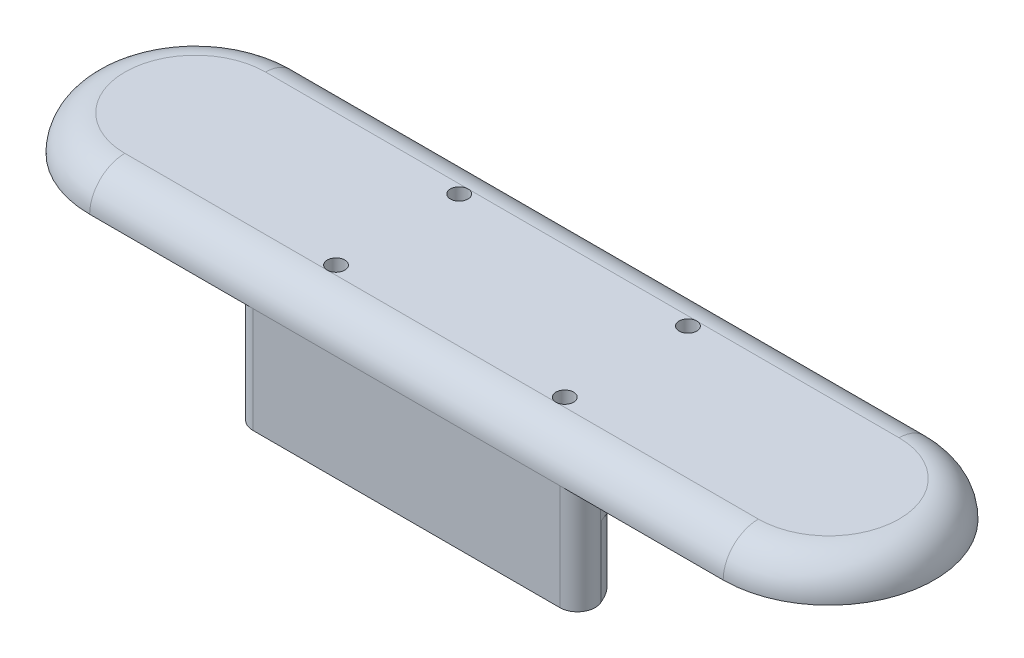
from build123d import *

# Parameters (mm, degrees)
BOSS_EXTRUDE1_DEPTH     = 40
FILLET1_R               = 10
CUT_EXTRUDE1_DEPTH      = 30
SKETCH4_R               = 5
BOSS_EXTRUDE3_DEPTH     = 10
CUT_EXTRUDE2_REACH      = 181.038
CUT_EXTRUDE2_END_RADIUS = 60
SKETCH5_W               = 20
SKETCH5_H               = 40
FILLET2_R               = 5
CUT_EXTRUDE3_REACH      = 153.142
SKETCH6_R               = 1
SKETCH7_R               = 2.5
CUT_EXTRUDE4_DEPTH      = 5
SKETCH8_R               = 6
CUT_EXTRUDE5_DEPTH      = 20
FILLET3_R               = 15


with BuildPart() as part:
    # Sketch1 → Boss-Extrude1 (new body)
    with BuildSketch(Plane(origin=(0, 0, 0), x_dir=(1, 0, 0), z_dir=(0, 1, 0))):
        with BuildLine():
            Line((-67.694698117, 31.515169882), (112.305301883, 31.515169882))
            ThreePointArc((112.305301883, 31.515169882), (142.305301883, 1.515169882), (112.305301883, -28.484830118))
            Line((112.305301883, -28.484830118), (-67.694698117, -28.484830118))
            ThreePointArc((-67.694698117, -28.484830118), (-97.694698117, 1.515169882), (-67.694698117, 31.515169882))
        make_face()
    extrude(amount=BOSS_EXTRUDE1_DEPTH)

    # Fillet1
    fillet1_edges = [part.edges().sort_by_distance(p)[0] for p in [
        (142.305301883, 40, -1.515169882),
        (22.305301883, 40, -31.515169882),
        (-97.694698117, 40, -1.515169882),
        (22.305301883, 40, 28.484830118),
    ]]
    fillet(fillet1_edges, radius=FILLET1_R)

    # Sketch3 → Cut-Extrude1 (cut)
    with BuildSketch(Plane.XZ):
        with BuildLine():
            Line((73.949041486, -31.515169882), (148.949041486, -31.515169882))
            Line((148.949041486, -31.515169882), (148.949041486, 28.484830118))
            Line((148.949041486, 28.484830118), (73.949041486, 28.484830118))
            ThreePointArc((73.949041486, 28.484830118), (65.910565713, -1.515169882), (73.949041486, -31.515169882))
        make_face()
        with BuildLine():
            Line((-29.33843772, 28.484830118), (-104.33843772, 28.484830118))
            Line((-104.33843772, 28.484830118), (-104.33843772, -31.515169882))
            Line((-104.33843772, -31.515169882), (-29.33843772, -31.515169882))
            ThreePointArc((-29.33843772, -31.515169882), (-21.299961947, -1.515169882), (-29.33843772, 28.484830118))
        make_face()
    extrude(amount=-CUT_EXTRUDE1_DEPTH, mode=Mode.SUBTRACT)

    # Sketch4 → Boss-Extrude3 (add)
    with BuildSketch(Plane(origin=(0, 30, 0), x_dir=(-1, 0, 0), z_dir=(0, -1, 0))):
        with Locations(Location((-112.305301883, 1.515169882, 0), (0, 0, 90))):
            Circle(SKETCH4_R)
        with Locations(Location((67.694698117, 1.515169882, 0), (0, 0, 270))):
            Circle(SKETCH4_R)
    extrude(amount=BOSS_EXTRUDE3_DEPTH)

    # Cut-Extrude2: up to this cylinder (the profile starts outside it)
    cut_extrude2_end = Plane(origin=(-81.299961947, 0, -1.515169882), z_dir=(0, -1, 0)) * Cylinder(CUT_EXTRUDE2_END_RADIUS, 483.076, mode=Mode.PRIVATE)
    # Sketch5 → Cut-Extrude2 (cut, up to the surface)
    with BuildSketch(Plane(origin=(73.949041486, 0, 0), x_dir=(0, 0, -1), z_dir=(1, 0, 0)), mode=Mode.PRIVATE) as cut_extrude2_sk1:
        with Locations((1.515169882, 0)):
            Rectangle(SKETCH5_W, SKETCH5_H)
    cut_extrude2_tool1 = extrude(cut_extrude2_sk1.sketch, amount=-CUT_EXTRUDE2_REACH, mode=Mode.PRIVATE) - cut_extrude2_end
    add(cut_extrude2_tool1.solids().sort_by_distance((73.949041, 0, -1.51517))[0], mode=Mode.SUBTRACT)

    # Fillet2
    # the kernel refuses this fillet: 5 mm, written as the material it takes off along each edge
    with BuildSketch(Plane(origin=(-29.33843772, -20.096189432, 28.484830118), x_dir=(0.44322659401027775, 0, -0.8964096085841831), z_dir=(0, 1, 0))) as fillet2_piece_1:
        with BuildLine():
            CenterArc((8.044914281, -4.989633951), FILLET2_R, 93.690067526, 112.619864948)
            Line((3.562866238, -7.205766921), (0, 0))
            ThreePointArc((0, 0), (3.861558855, -0.124392586), (7.72311771, 0))
        make_face()
    extrude(amount=50.096189432, mode=Mode.SUBTRACT)
    with BuildSketch(Plane(origin=(-29.33843772, -20.096189432, -31.515169882), x_dir=(1, 0, 0), z_dir=(0, 1, 0))) as fillet2_piece_2:
        with BuildLine():
            CenterArc((8.038475773, -5), FILLET2_R, 90, 112.619864948)
            ThreePointArc((3.423091158, -6.923076923), (1.823052288, -3.406404359), (0, 0))
            Line((0, 0), (8.038475773, 0))
        make_face()
    extrude(amount=50.096189432, mode=Mode.SUBTRACT)
    with BuildSketch(Plane(origin=(73.949041486, -20.096189432, -31.515169882), x_dir=(-1, 0, 0), z_dir=(0, 1, 0))) as fillet2_piece_3:
        with BuildLine():
            CenterArc((8.038475773, 5), FILLET2_R, 157.380135052, 112.619864948)
            ThreePointArc((3.423091158, 6.923076923), (1.823052288, 3.406404359), (0, 0))
            Line((0, 0), (8.038475773, 0))
        make_face()
    extrude(amount=50.096189432, mode=Mode.SUBTRACT)
    with BuildSketch(Plane(origin=(73.949041486, -20.096189432, 28.484830118), x_dir=(-0.4432265940102763, 0, -0.8964096085841838), z_dir=(0, 1, 0))) as fillet2_piece_4:
        with BuildLine():
            CenterArc((8.044914281, 4.989633951), FILLET2_R, 153.690067526, 112.619864948)
            Line((3.562866238, 7.205766921), (0, 0))
            ThreePointArc((0, 0), (3.861558855, 0.124392586), (7.72311771, 0))
        make_face()
    extrude(amount=50.096189432, mode=Mode.SUBTRACT)

    # Sketch6 → Cut-Extrude3 (cut, up to next)
    with BuildSketch(Plane(origin=(0, 0, 0), x_dir=(-1, 0, 0), z_dir=(0, -1, 0)), mode=Mode.PRIVATE) as cut_extrude3_sk1:
        with Locations(Location((10.194698117, -15.984830118, 0), (0, 0, 90))):
            Circle(SKETCH6_R)
    cut_extrude3_tool1 = extrude(cut_extrude3_sk1.sketch, amount=-CUT_EXTRUDE3_REACH, mode=Mode.PRIVATE) & part.part
    # Sketch6 → Cut-Extrude3 (cut, up to next)
    with BuildSketch(Plane(origin=(0, 0, 0), x_dir=(-1, 0, 0), z_dir=(0, -1, 0)), mode=Mode.PRIVATE) as cut_extrude3_sk2:
        with Locations(Location((-54.805301883, -15.984830118, 0), (0, 0, 90))):
            Circle(SKETCH6_R)
    cut_extrude3_tool2 = extrude(cut_extrude3_sk2.sketch, amount=-CUT_EXTRUDE3_REACH, mode=Mode.PRIVATE) & part.part
    # Sketch6 → Cut-Extrude3 (cut, up to next)
    with BuildSketch(Plane(origin=(0, 0, 0), x_dir=(-1, 0, 0), z_dir=(0, -1, 0)), mode=Mode.PRIVATE) as cut_extrude3_sk3:
        with Locations(Location((-54.805301883, 19.015169882, 0), (0, 0, 90))):
            Circle(SKETCH6_R)
    cut_extrude3_tool3 = extrude(cut_extrude3_sk3.sketch, amount=-CUT_EXTRUDE3_REACH, mode=Mode.PRIVATE) & part.part
    # Sketch6 → Cut-Extrude3 (cut, up to next)
    with BuildSketch(Plane(origin=(0, 0, 0), x_dir=(-1, 0, 0), z_dir=(0, -1, 0)), mode=Mode.PRIVATE) as cut_extrude3_sk4:
        with Locations(Location((10.194698117, 19.015169882, 0), (0, 0, 90))):
            Circle(SKETCH6_R)
    cut_extrude3_tool4 = extrude(cut_extrude3_sk4.sketch, amount=-CUT_EXTRUDE3_REACH, mode=Mode.PRIVATE) & part.part
    add(cut_extrude3_tool1.solids().sort_by_distance((-10.194698, 0, 15.98483))[0], mode=Mode.SUBTRACT)
    add(cut_extrude3_tool2.solids().sort_by_distance((54.805302, 0, 15.98483))[0], mode=Mode.SUBTRACT)
    add(cut_extrude3_tool3.solids().sort_by_distance((54.805302, 0, -19.01517))[0], mode=Mode.SUBTRACT)
    add(cut_extrude3_tool4.solids().sort_by_distance((-10.194698, 0, -19.01517))[0], mode=Mode.SUBTRACT)

    # Sketch7 → Cut-Extrude4 (cut)
    with BuildSketch(Plane(origin=(0, 40, 0), x_dir=(1, 0, 0), z_dir=(0, 1, 0))):
        with Locations(Location((-10.194698117, 19.015169882, 0), (0, 0, 270))):
            Circle(SKETCH7_R)
        with Locations(Location((-10.194698117, -15.984830118, 0), (0, 0, 270))):
            Circle(SKETCH7_R)
        with Locations(Location((54.805301883, -15.984830118, 0), (0, 0, 270))):
            Circle(SKETCH7_R)
        with Locations(Location((54.805301883, 19.015169882, 0), (0, 0, 270))):
            Circle(SKETCH7_R)
    extrude(amount=-CUT_EXTRUDE4_DEPTH, mode=Mode.SUBTRACT)

    # Sketch8 → Cut-Extrude5 (cut)
    with BuildSketch(Plane.XZ):
        with Locations((-22.139164116, 8.484830118)):
            Circle(SKETCH8_R)
        with Locations((-22.139164116, -11.515169882)):
            Circle(SKETCH8_R)
        with Locations((66.749767882, -11.515169882)):
            Circle(SKETCH8_R)
        with Locations((66.749767882, 8.484830118)):
            Circle(SKETCH8_R)
    extrude(amount=-CUT_EXTRUDE5_DEPTH, mode=Mode.SUBTRACT)

    # Fillet3
    fillet3_edges = [part.edges().sort_by_distance(p)[0] for p in [
        (-16.139164116, 10, -11.515169882),
        (60.749767882, 10, -11.515169882),
        (68.044321089, 10, 14.343510174),
        (60.749767882, 10, 8.484830118),
        (68.044321089, 10, -17.373849938),
        (-23.433717323, 10, -17.373849938),
        (-23.433717323, 10, 14.343510174),
        (-16.139164116, 10, 8.484830118),
    ]]
    fillet(fillet3_edges, radius=FILLET3_R)


solid = part.part
